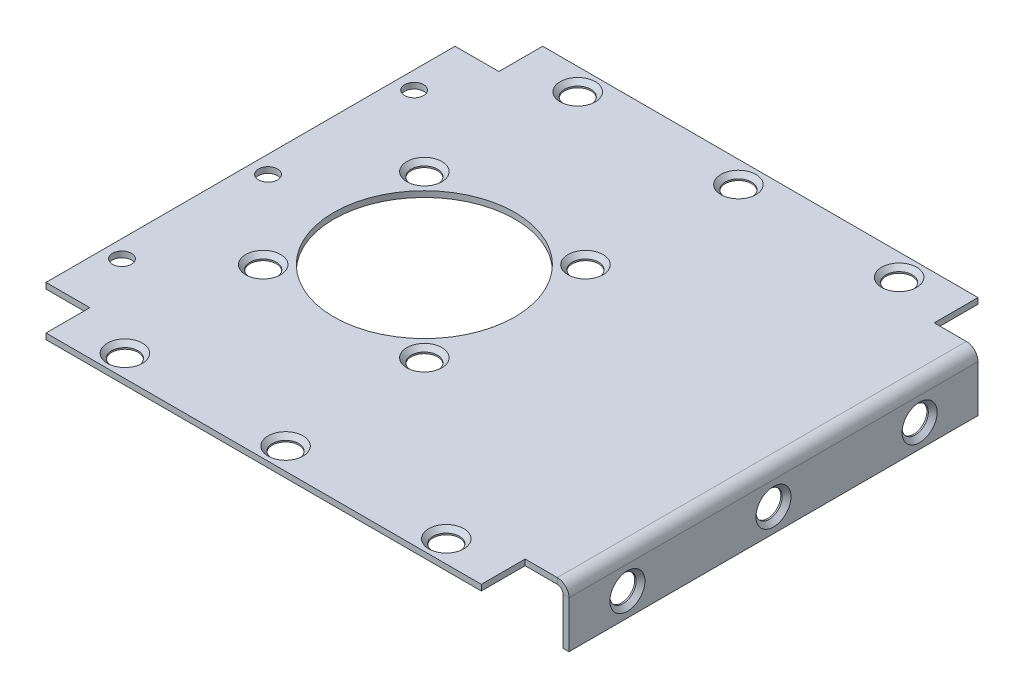
from build123d import *

# Parameters (mm, degrees)
SM_BASE_FLANGE_1_DEPTH = 70
SKETCH_3_R             = 31
SKETCH_3_R_2           = 3.25
CUT_EXTRUDE_1_DEPTH    = 2
SKETCH_4_W             = 149
SKETCH_4_H             = 2
EXTRUDE_2_DEPTH        = 15
SKETCH_5_W             = 149
SKETCH_5_H             = 2
EXTRUDE_3_DEPTH        = 15


# Sheet-metal steps are written as plain solids
with BuildPart() as part:
    # Sketch 1 → Базовая кромка1 (new, symmetric)
    with BuildSketch(Plane.XY):
        with BuildLine():
            Line((0, 0), (175, 0))
            ThreePointArc((175, 0), (177.828427125, -1.171572875), (179, -4))
            Line((179, -4), (179, -20))
            Line((179, -20), (177, -20))
            Line((177, -20), (177, -4))
            ThreePointArc((177, -4), (176.414213562, -2.585786438), (175, -2))
            Line((175, -2), (0, -2))
            Line((0, -2), (0, 0))
        make_face()
    extrude(amount=SM_BASE_FLANGE_1_DEPTH, both=True)

    # Эскиз3 → Вытянуть1 (cut)
    with BuildSketch(Plane(origin=(0, 0, 0), x_dir=(1, 0, 0), z_dir=(0, 1, 0))):
        with Locations(Location((59.5, 0, 0), (0, 0, 270))):
            Circle(SKETCH_3_R)
        with Locations(Location((6, 50, 0), (0, 0, 270))):
            Circle(SKETCH_3_R_2)
        with Locations(Location((6, 0, 0), (0, 0, 270))):
            Circle(SKETCH_3_R_2)
        with Locations(Location((6, -50, 0), (0, 0, 270))):
            Circle(SKETCH_3_R_2)
    extrude(amount=-CUT_EXTRUDE_1_DEPTH, mode=Mode.SUBTRACT)

    # Эскиз4 → Вытянуть2 (add)
    with BuildSketch(Plane.XY.offset(70)):
        with Locations((89.5, -1)):
            Rectangle(SKETCH_4_W, SKETCH_4_H)
    extrude(amount=EXTRUDE_2_DEPTH)

    # Эскиз5 → Вытянуть3 (add)
    with BuildSketch(Plane(origin=(0, 0, -70), x_dir=(-1, 0, 0), z_dir=(0, 0, -1))):
        with Locations((-89.5, -1)):
            Rectangle(SKETCH_5_W, SKETCH_5_H)
    extrude(amount=EXTRUDE_3_DEPTH)

    # Эскиз8 → Зенковка для винта с потайной головкой M61 (revolve, cut)
    with BuildSketch(Plane(origin=(34.5, 0, 77.5), x_dir=(0, 0, 1), z_dir=(1, 0, 0))):
        Polygon((0, 0), (0, 2), (4.5, 2), (4.5, 1.5), (6, 0), align=None)
    revolve(axis=Axis((34.5, 6.35, 77.5), (0, -1, 0)), mode=Mode.SUBTRACT)

    # Эскиз8 at point 2 (carried to point 2, square into its face) → Зенковка для винта с потайной головкой M61 at 2 (revolve, cut)
    with BuildSketch(Plane(origin=(89.5, 0, 77.5), x_dir=(0, 0, 1), z_dir=(1, 0, 0))):
        Polygon((0, 0), (0, 2), (4.5, 2), (4.5, 1.5), (6, 0), align=None)
    revolve(axis=Axis((89.5, 6.35, 77.5), (0, -1, 0)), mode=Mode.SUBTRACT)

    # Эскиз8 at point 3 (carried to point 3, square into its face) → Зенковка для винта с потайной головкой M61 at 3 (revolve, cut)
    with BuildSketch(Plane(origin=(144.5, 0, 77.5), x_dir=(0, 0, 1), z_dir=(1, 0, 0))):
        Polygon((0, 0), (0, 2), (4.5, 2), (4.5, 1.5), (6, 0), align=None)
    revolve(axis=Axis((144.5, 6.35, 77.5), (0, -1, 0)), mode=Mode.SUBTRACT)

    # Эскиз8 at point 4 (carried to point 4, square into its face) → Зенковка для винта с потайной головкой M61 at 4 (revolve, cut)
    with BuildSketch(Plane(origin=(31.922835534, 0, 27.577164466), x_dir=(0, 0, 1), z_dir=(1, 0, 0))):
        Polygon((0, 0), (0, 2), (4.5, 2), (4.5, 1.5), (6, 0), align=None)
    revolve(axis=Axis((31.922835534, 6.35, 27.577164466), (0, -1, 0)), mode=Mode.SUBTRACT)

    # Эскиз8 at point 5 (carried to point 5, square into its face) → Зенковка для винта с потайной головкой M61 at 5 (revolve, cut)
    with BuildSketch(Plane(origin=(87.077164466, 0, 27.577164466), x_dir=(0, 0, 1), z_dir=(1, 0, 0))):
        Polygon((0, 0), (0, 2), (4.5, 2), (4.5, 1.5), (6, 0), align=None)
    revolve(axis=Axis((87.077164466, 6.35, 27.577164466), (0, -1, 0)), mode=Mode.SUBTRACT)

    # Эскиз8 at point 6 (carried to point 6, square into its face) → Зенковка для винта с потайной головкой M61 at 6 (revolve, cut)
    with BuildSketch(Plane(origin=(87.077164466, 0, -27.577164466), x_dir=(0, 0, 1), z_dir=(1, 0, 0))):
        Polygon((0, 0), (0, 2), (4.5, 2), (4.5, 1.5), (6, 0), align=None)
    revolve(axis=Axis((87.077164466, 6.35, -27.577164466), (0, -1, 0)), mode=Mode.SUBTRACT)

    # Эскиз8 at point 7 (carried to point 7, square into its face) → Зенковка для винта с потайной головкой M61 at 7 (revolve, cut)
    with BuildSketch(Plane(origin=(31.922835534, 0, -27.577164466), x_dir=(0, 0, 1), z_dir=(1, 0, 0))):
        Polygon((0, 0), (0, 2), (4.5, 2), (4.5, 1.5), (6, 0), align=None)
    revolve(axis=Axis((31.922835534, 6.35, -27.577164466), (0, -1, 0)), mode=Mode.SUBTRACT)

    # Эскиз8 at point 8 (carried to point 8, square into its face) → Зенковка для винта с потайной головкой M61 at 8 (revolve, cut)
    with BuildSketch(Plane(origin=(34.5, 0, -77.5), x_dir=(0, 0, 1), z_dir=(1, 0, 0))):
        Polygon((0, 0), (0, 2), (4.5, 2), (4.5, 1.5), (6, 0), align=None)
    revolve(axis=Axis((34.5, 6.35, -77.5), (0, -1, 0)), mode=Mode.SUBTRACT)

    # Эскиз8 at point 9 (carried to point 9, square into its face) → Зенковка для винта с потайной головкой M61 at 9 (revolve, cut)
    with BuildSketch(Plane(origin=(89.5, 0, -77.5), x_dir=(0, 0, 1), z_dir=(1, 0, 0))):
        Polygon((0, 0), (0, 2), (4.5, 2), (4.5, 1.5), (6, 0), align=None)
    revolve(axis=Axis((89.5, 6.35, -77.5), (0, -1, 0)), mode=Mode.SUBTRACT)

    # Эскиз8 at point 10 (carried to point 10, square into its face) → Зенковка для винта с потайной головкой M61 at 10 (revolve, cut)
    with BuildSketch(Plane(origin=(144.5, 0, -77.5), x_dir=(0, 0, 1), z_dir=(1, 0, 0))):
        Polygon((0, 0), (0, 2), (4.5, 2), (4.5, 1.5), (6, 0), align=None)
    revolve(axis=Axis((144.5, 6.35, -77.5), (0, -1, 0)), mode=Mode.SUBTRACT)

    # Эскиз8 at point 11 (carried to point 11, square into its face) → Зенковка для винта с потайной головкой M61 at 11 (revolve, cut)
    with BuildSketch(Plane(origin=(179, -12, 50), x_dir=(0, 0, 1), z_dir=(0, -1, 0))):
        Polygon((0, 0), (0, 2), (4.5, 2), (4.5, 1.5), (6, 0), align=None)
    revolve(axis=Axis((185.35, -12, 50), (-1, 0, 0)), mode=Mode.SUBTRACT)

    # Эскиз8 at point 12 (carried to point 12, square into its face) → Зенковка для винта с потайной головкой M61 at 12 (revolve, cut)
    with BuildSketch(Plane(origin=(179, -12, 0), x_dir=(0, 0, 1), z_dir=(0, -1, 0))):
        Polygon((0, 0), (0, 2), (4.5, 2), (4.5, 1.5), (6, 0), align=None)
    revolve(axis=Axis((185.35, -12, 0), (-1, 0, 0)), mode=Mode.SUBTRACT)

    # Эскиз8 at point 13 (carried to point 13, square into its face) → Зенковка для винта с потайной головкой M61 at 13 (revolve, cut)
    with BuildSketch(Plane(origin=(179, -12, -50), x_dir=(0, 0, 1), z_dir=(0, -1, 0))):
        Polygon((0, 0), (0, 2), (4.5, 2), (4.5, 1.5), (6, 0), align=None)
    revolve(axis=Axis((185.35, -12, -50), (-1, 0, 0)), mode=Mode.SUBTRACT)


solid = part.part
